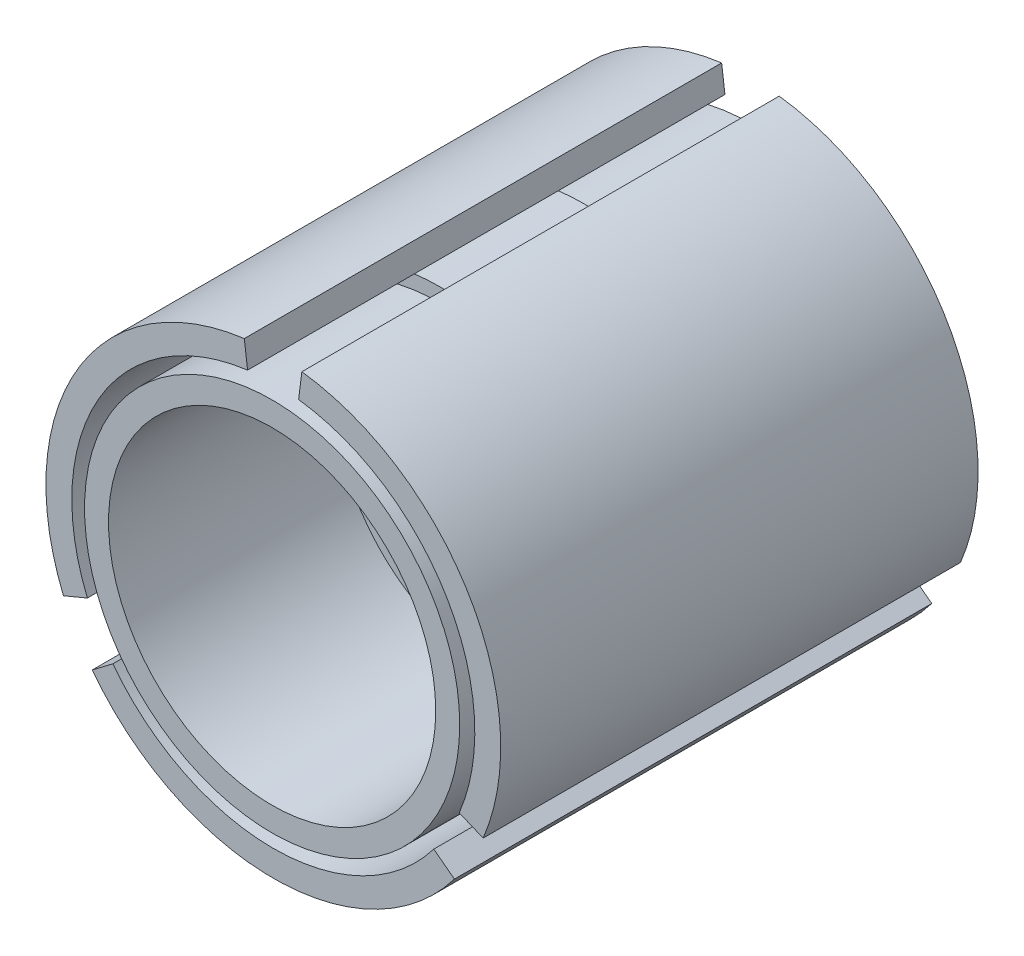
from build123d import *

# Parameters (mm, degrees)
CROQUIS1_R                   = 42
SALIENTE_EXTRUIR1_DEPTH      = 15
SALIENTE_EXTRUIR2_DEPTH      = 15
SALIENTE_EXTRUIR2_2_DEPTH    = 15
SALIENTE_EXTRUIR2_3_DEPTH    = 15
SALIENTE_EXTRUIR3_DEPTH      = 49.75
SALIENTE_EXTRUIR4_DEPTH      = 50
SALIENTE_EXTRUIR4_DEPTH_BACK = 49.75
CROQUIS4_R                   = 39.1
CROQUIS5_R                   = 34.1
CORTAR_EXTRUIR1_DEPTH        = 47
CORTAR_EXTRUIR2_START        = -47
CROQUIS6_R                   = 34.1
CORTAR_EXTRUIR2_DEPTH        = 47
CORTAR_EXTRUIR3_DEPTH        = 84.627236588
CORTAR_EXTRUIR3_DEPTH_BACK   = 84.627236588
CROQUIS7_R                   = 1.75


with BuildPart() as part:
    # Croquis1 → Saliente-Extruir1 (new, symmetric)
    with BuildSketch(Plane.XY):
        Circle(CROQUIS1_R)
    extrude(amount=SALIENTE_EXTRUIR1_DEPTH, both=True)



with BuildPart() as body_2:
    # Croquis2 → Saliente-Extruir2 (new, symmetric)
    with BuildSketch(Plane.XY):
        with BuildLine():
            Line((-6, 46.615448083), (-5.361702128, 41.656357862))
            ThreePointArc((-5.361702128, 41.656357862), (-36.373066959, 21), (-38.756315201, -16.184808681))
            Line((-38.756315201, -16.184808681), (-43.370162249, -18.111571619))
            ThreePointArc((-43.370162249, -18.111571619), (-40.703193978, 23.5), (-6, 46.615448083))
        make_face()
    extrude(amount=SALIENTE_EXTRUIR2_DEPTH, both=True)


with BuildPart() as body_3:
    # Croquis2 → Saliente-Extruir2 2 (new, symmetric)
    with BuildSketch(Plane.XY):
        with BuildLine():
            Line((6, 46.615448083), (5.361702128, 41.656357862))
            ThreePointArc((5.361702128, 41.656357862), (36.373066959, 21), (38.756315201, -16.184808681))
            Line((38.756315201, -16.184808681), (43.370162249, -18.111571619))
            ThreePointArc((43.370162249, -18.111571619), (40.703193978, 23.5), (6, 46.615448083))
        make_face()
    extrude(amount=SALIENTE_EXTRUIR2_2_DEPTH, both=True)


with BuildPart() as body_4:
    # Croquis2 → Saliente-Extruir2 3 (new, symmetric)
    with BuildSketch(Plane.XY):
        with BuildLine():
            Line((37.370162249, -28.503876464), (33.394613073, -25.471549181))
            ThreePointArc((33.394613073, -25.471549181), (0, -42), (-33.394613073, -25.471549181))
            Line((-33.394613073, -25.471549181), (-37.370162249, -28.503876464))
            ThreePointArc((-37.370162249, -28.503876464), (0, -47), (37.370162249, -28.503876464))
        make_face()
    extrude(amount=SALIENTE_EXTRUIR2_3_DEPTH, both=True)


with BuildPart() as part_1:
    add(part.part)

    add(body_2.part)  # Saliente-Extruir3 merges body 2

    add(body_3.part)  # Saliente-Extruir3 merges body 3

    add(body_4.part)  # Saliente-Extruir3 merges body 4
    # Croquis3 → Saliente-Extruir3 (add, symmetric)
    with BuildSketch(Plane.XY):
        with BuildLine():
            Line((-5.361702128, 41.656357862), (-6.051060261, 47.012147572))
            ThreePointArc((-6.051060261, 47.012147572), (-41.049579928, 23.699986021), (-43.739244215, -18.265701881))
            Line((-43.739244215, -18.265701881), (-38.756315201, -16.184808681))
            ThreePointArc((-38.756315201, -16.184808681), (-36.373066959, 21), (-5.361702128, 41.656357862))
        make_face()
        with BuildLine():
            Line((5.271215536, 41.667904756), (5.948939739, 47.02517906))
            ThreePointArc((5.948939739, 47.02517906), (41.023818565, 23.744550111), (43.739244215, -18.265701881))
            Line((43.739244215, -18.265701881), (38.756315201, -16.184808681))
            ThreePointArc((38.756315201, -16.184808681), (36.350240422, 21.039487192), (5.271215536, 41.667904756))
        make_face()
        with BuildLine():
            Line((37.750534128, -28.664516789), (33.449860096, -25.398953907))
            ThreePointArc((33.449860096, -25.398953907), (0, -42), (-33.449860096, -25.398953907))
            Line((-33.449860096, -25.398953907), (-37.750534128, -28.664516789))
            ThreePointArc((-37.750534128, -28.664516789), (0, -47.399972043), (37.750534128, -28.664516789))
        make_face()
    extrude(amount=SALIENTE_EXTRUIR3_DEPTH, both=True)

    # Croquis4 → Saliente-Extruir4 (add, two sides: drawn at the far end of the back side and taken through both)
    with BuildSketch(Plane.XY.offset(-SALIENTE_EXTRUIR4_DEPTH_BACK)):
        Circle(CROQUIS4_R)
    extrude(amount=SALIENTE_EXTRUIR4_DEPTH + SALIENTE_EXTRUIR4_DEPTH_BACK)

    # Croquis5 → Cortar-Extruir1 (cut)
    with BuildSketch(Plane.XY.offset(50)):
        Circle(CROQUIS5_R)
    extrude(amount=-CORTAR_EXTRUIR1_DEPTH, mode=Mode.SUBTRACT)

    # Croquis6 → Cortar-Extruir2 (cut)
    with BuildSketch(Plane(origin=(0, 0, -49.75), x_dir=(-1, 0, 0), z_dir=(0, 0, -1)).offset(CORTAR_EXTRUIR2_START)):
        Circle(CROQUIS6_R)
    extrude(amount=CORTAR_EXTRUIR2_DEPTH, mode=Mode.SUBTRACT)

    # Croquis7 → Cortar-Extruir3 (cut, two sides: drawn at the far end of the back side and taken through both)
    with BuildSketch(Plane.XY.offset(-CORTAR_EXTRUIR3_DEPTH_BACK)):
        with Locations((5, 5)):
            Circle(CROQUIS7_R)
        with Locations((-5, 5)):
            Circle(CROQUIS7_R)
        with Locations((-5, -5)):
            Circle(CROQUIS7_R)
        with Locations((5, -5)):
            Circle(CROQUIS7_R)
    extrude(amount=CORTAR_EXTRUIR3_DEPTH + CORTAR_EXTRUIR3_DEPTH_BACK, mode=Mode.SUBTRACT)


solid = part_1.part
